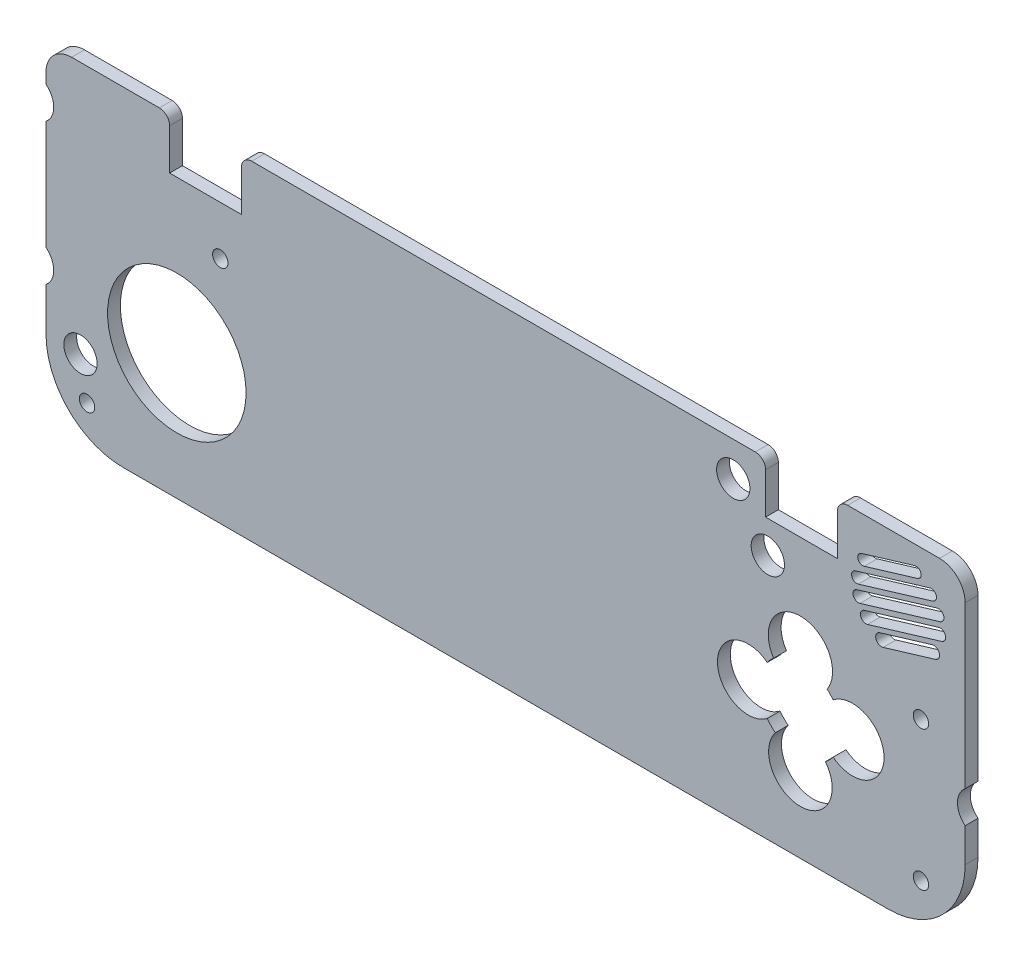
from build123d import *

# Parameters (mm, degrees)
BOSS_EXTRU_1_DEPTH       = 2.5
ENL_V_MAT_EXTRU_14_DEPTH = 10
JOYSTICK_R               = 13.5
ENL_V_MAT_EXTRU_2_DEPTH  = 2.5
ESQUISSE2_W              = 14
ESQUISSE2_H              = 10
ENL_V_MAT_EXTRU_3_DEPTH  = 10
CONG_1_R                 = 2
CONG_2_R                 = 2
ESQUISSE3_W              = 14
ESQUISSE3_H              = 10
ENL_V_MAT_EXTRU_4_DEPTH  = 10
CONG_3_R                 = 2
CONG_4_R                 = 2
ENL_V_MAT_EXTRU_8_DEPTH  = 10
ESQUISSE5_R              = 1.5
ESQUISSE5_R_2            = 3.25
ENL_V_MAT_EXTRU_9_DEPTH  = 10
ESQUISSE6_R              = 4
ENL_V_MAT_EXTRU_15_DEPTH = 10


with BuildPart() as part:
    # Esquisse1 → Boss.-Extru.1 (new body)
    with BuildSketch(Plane.XY):
        with BuildLine():
            Line((-89.203921136, 33.34478673), (79.966078864, 33.34478673))
            ThreePointArc((79.966078864, 33.34478673), (83.50161277, 31.880320636), (84.966078864, 28.34478673))
            Line((84.966078864, 28.34478673), (84.966078864, -15.88521327))
            ThreePointArc((84.966078864, -15.88521327), (80.572680581, -26.491814988), (69.966078864, -30.88521327))
            Line((69.966078864, -30.88521327), (-79.203921136, -30.88521327))
            ThreePointArc((-79.203921136, -30.88521327), (-89.810522854, -26.491814988), (-94.203921136, -15.88521327))
            Line((-94.203921136, -15.88521327), (-94.203921136, 28.34478673))
            ThreePointArc((-94.203921136, 28.34478673), (-92.739455042, 31.880320636), (-89.203921136, 33.34478673))
        make_face()
    extrude(amount=BOSS_EXTRU_1_DEPTH)

    # 12x12 Button → Enlèv. mat.-Extru.14 (cut)
    with BuildSketch(Plane.XY.offset(2.5)):
        with BuildLine():
            ThreePointArc((59.220398192, -0.921151245), (58.674503702, -0.275289323), (58.063482277, 0.309339821))
            ThreePointArc((58.063482276, 0.309339821), (52.849240894, 10.038221143), (47.62517912, 0.314609492))
            ThreePointArc((47.62517912, 0.314609491), (46.965240695, -0.322324083), (46.382477581, -1.030554452))
            ThreePointArc((46.382477581, -1.030554452), (36.687266101, -5.758353734), (46.387422405, -10.475999265))
            ThreePointArc((46.387422405, -10.475999265), (47.121070973, -11.343088385), (47.970121608, -12.097539697))
            ThreePointArc((47.970121608, -12.097539697), (52.846080853, -22.107917903), (57.722033666, -12.097536564))
            ThreePointArc((57.722033666, -12.097536564), (58.521539603, -11.393399627), (59.220393145, -10.589271343))
            ThreePointArc((59.220393145, -10.589271343), (69.146073474, -5.755216476), (59.220398192, -0.921151245))
        make_face()
    extrude(amount=-ENL_V_MAT_EXTRU_14_DEPTH, mode=Mode.SUBTRACT)

    # Joystick → Enlèv. mat.-Extru.2 (cut)
    with BuildSketch(Plane.XY.offset(2.5)):
        with Locations((-68.703921136, -6.32521327)):
            Circle(JOYSTICK_R)
    extrude(amount=-ENL_V_MAT_EXTRU_2_DEPTH, mode=Mode.SUBTRACT)

    # Esquisse2 → Enlèv. mat.-Extru.3 (cut)
    with BuildSketch(Plane.XY.offset(2.5)):
        with Locations((53.056078864, 28.34478673)):
            Rectangle(ESQUISSE2_W, ESQUISSE2_H)
    extrude(amount=-ENL_V_MAT_EXTRU_3_DEPTH, mode=Mode.SUBTRACT)

    # Congé1
    cong_1_edges = [part.edges().sort_by_distance(p)[0] for p in [
        (46.056078864, 33.34478673, 1.25),
    ]]
    fillet(cong_1_edges, radius=CONG_1_R)

    # Congé2
    cong_2_edges = [part.edges().sort_by_distance(p)[0] for p in [
        (60.056078864, 33.34478673, 1.25),
    ]]
    fillet(cong_2_edges, radius=CONG_2_R)

    # Esquisse3 → Enlèv. mat.-Extru.4 (cut)
    with BuildSketch(Plane.XY.offset(2.5)):
        with Locations((-63.103921136, 28.34478673)):
            Rectangle(ESQUISSE3_W, ESQUISSE3_H)
    extrude(amount=-ENL_V_MAT_EXTRU_4_DEPTH, mode=Mode.SUBTRACT)

    # Congé3
    cong_3_edges = [part.edges().sort_by_distance(p)[0] for p in [
        (-70.103921136, 33.34478673, 1.25),
    ]]
    fillet(cong_3_edges, radius=CONG_3_R)

    # Congé4
    cong_4_edges = [part.edges().sort_by_distance(p)[0] for p in [
        (-56.103921136, 33.34478673, 1.25),
    ]]
    fillet(cong_4_edges, radius=CONG_4_R)

    # Esquisse4 → Enlèv. mat.-Extru.8 (cut)
    with BuildSketch(Plane.XY.offset(2.5)):
        with BuildLine():
            ThreePointArc((63.848163441, 19.991775112), (63.146749084, 18.684402623), (64.454121573, 17.982988266))
            Line((64.454121573, 17.982988266), (80.083994286, 22.697798347))
            ThreePointArc((80.083994286, 22.697798347), (80.785408643, 24.005170837), (79.478036154, 24.706585194))
            Line((79.478036154, 24.706585194), (63.848163441, 19.991775112))
        make_face()
        with BuildLine():
            ThreePointArc((63.539756046, 23.02230266), (62.859334743, 21.754059311), (64.127578092, 21.073638007))
            Line((64.127578092, 21.073638007), (78.646973349, 25.453468374))
            ThreePointArc((78.646973349, 25.453468374), (79.327394653, 26.721711723), (78.059151304, 27.402133027))
            Line((78.059151304, 27.402133027), (63.539756046, 23.02230266))
        make_face()
        with BuildLine():
            ThreePointArc((65.314724126, 17.237366416), (64.591788009, 15.889879327), (65.939275099, 15.166943211))
            Line((65.939275099, 15.166943211), (80.403820915, 19.530228036))
            ThreePointArc((80.403820915, 19.530228036), (81.126757031, 20.877715126), (79.779269942, 21.600651242))
            Line((79.779269942, 21.600651242), (65.314724126, 17.237366416))
        make_face()
        with BuildLine():
            ThreePointArc((64.721267087, 26.554024385), (64.061810556, 25.324857462), (65.290977478, 24.665400931))
            Line((65.290977478, 24.665400931), (75.691438685, 27.802739299))
            ThreePointArc((75.691438685, 27.802739299), (76.350895216, 29.031906221), (75.121728293, 29.691362753))
            Line((75.121728293, 29.691362753), (64.721267087, 26.554024385))
        make_face()
        with BuildLine():
            ThreePointArc((68.322797362, 14.963301678), (67.571229601, 13.562447811), (68.972083468, 12.810880049))
            Line((68.972083468, 12.810880049), (79.179793957, 15.890074436))
            ThreePointArc((79.179793957, 15.890074436), (79.931361718, 17.290928304), (78.530507851, 18.042496065))
            Line((78.530507851, 18.042496065), (68.322797362, 14.963301678))
        make_face()
    extrude(amount=-ENL_V_MAT_EXTRU_8_DEPTH, mode=Mode.SUBTRACT)

    # Esquisse5 → Enlèv. mat.-Extru.9 (cut)
    with BuildSketch(Plane.XY.offset(2.5)):
        with Locations((76.346078864, -22.88521327)):
            Circle(ESQUISSE5_R)
        with Locations((-86.203921136, -23.53521327)):
            Circle(ESQUISSE5_R)
        with Locations((76.346078864, 4.34478673)):
            Circle(ESQUISSE5_R)
        with Locations((-60.233921136, 13.83478673)):
            Circle(ESQUISSE5_R)
        with Locations((-87.483921136, -15.91521327)):
            Circle(ESQUISSE5_R_2)
        with Locations((39.756078864, 26.62478673)):
            Circle(ESQUISSE5_R_2)
        with Locations((46.496078864, 17.10478673)):
            Circle(ESQUISSE5_R_2)
    extrude(amount=-ENL_V_MAT_EXTRU_9_DEPTH, mode=Mode.SUBTRACT)

    # Esquisse6 → Enlèv. mat.-Extru.15 (cut)
    with BuildSketch(Plane.XY.offset(2.5)):
        with Locations((-96.703921136, -4.38521327)):
            Circle(ESQUISSE6_R)
        with Locations((-96.703921136, 23.15478673)):
            Circle(ESQUISSE6_R)
        with Locations((87.466078864, -6.16521327)):
            Circle(ESQUISSE6_R)
    extrude(amount=-ENL_V_MAT_EXTRU_15_DEPTH, mode=Mode.SUBTRACT)


solid = part.part
